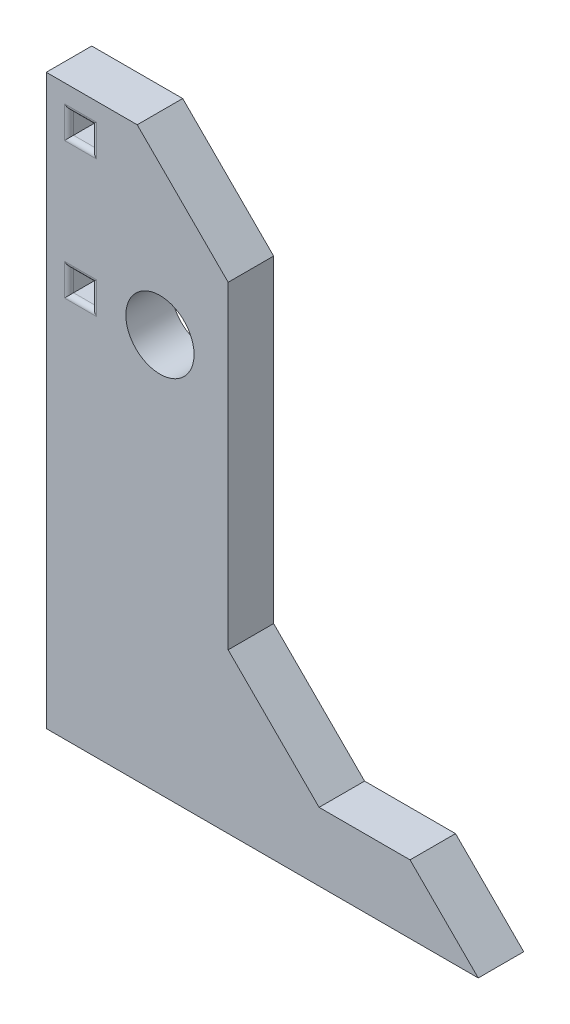
from build123d import *

# Parameters (mm, degrees)
SKETCH3_R           = 15
SKETCH3_W           = 80
SKETCH3_H           = 30
BOSS_EXTRUDE2_DEPTH = 20
SKETCH4_W           = 10
SKETCH4_H           = 10
CUT_EXTRUDE1_DEPTH  = 20
CHAMFER1_SIZE       = 40
FILLET1_R           = 2


with BuildPart() as part:
    # Sketch3 → Boss-Extrude2 (new body)
    # profile 1 of 7: a face of its own
    with BuildSketch(Plane.XY):
        Polygon((-80, 75), (-80, 25), (-80, -26.993709631), (-80, -145), (0, -145), (0, 75), align=None)
        with Locations((-30, 0)):
            Circle(SKETCH3_R, mode=Mode.SUBTRACT)
    # profile 2 of 7: a face of its own
    with BuildSketch(Plane.XY):
        Polygon((-80, 75), (-80, 25), (-80, -26.993709631), (-80, -145), (0, -145), (0, 75), align=None)
        with Locations((-30, 0)):
            Circle(SKETCH3_R, mode=Mode.SUBTRACT)
    # profile 3 of 7: a face of its own
    with BuildSketch(Plane.XY):
        Polygon((-80, 75), (-80, 25), (-80, -26.993709631), (-80, -145), (0, -145), (0, 75), align=None)
        with Locations((-30, 0)):
            Circle(SKETCH3_R, mode=Mode.SUBTRACT)
    # profile 4 of 7: a face of its own
    with BuildSketch(Plane.XY):
        with Locations((-40, -160)):
            Rectangle(SKETCH3_W, SKETCH3_H)
    # profile 5 of 7: a face of its own
    with BuildSketch(Plane.XY):
        with Locations((-40, -160)):
            Rectangle(SKETCH3_W, SKETCH3_H)
    # profile 6 of 7: a face of its own
    with BuildSketch(Plane.XY):
        with Locations((-40, -160)):
            Rectangle(SKETCH3_W, SKETCH3_H)
    # profile 7 of 7: a face of its own
    with BuildSketch(Plane.XY):
        Polygon((120, -145), (0, -145), (0, -175), (53.438707699, -175), (120, -175), align=None)
    extrude(amount=BOSS_EXTRUDE2_DEPTH)

    # Sketch4 → Cut-Extrude1 (cut)
    with BuildSketch(Plane.XY.offset(20)):
        with Locations((-65, 60)):
            Rectangle(SKETCH4_W, SKETCH4_H)
        with Locations((-65, 0)):
            Rectangle(SKETCH4_W, SKETCH4_H)
    extrude(amount=-CUT_EXTRUDE1_DEPTH, mode=Mode.SUBTRACT)

    # Chamfer1
    # the kernel refuses this chamfer: 40 mm, written as the material it adds along each edge
    with BuildSketch(Plane(origin=(0, -145, 0), x_dir=(-0.027495876610586535, 0.9996219169112968, 0), z_dir=(0, 0, 1))) as chamfer1_piece_1:
        Polygon((CHAMFER1_SIZE * 0.999621916911, -CHAMFER1_SIZE * 0.0274958766106), (-CHAMFER1_SIZE * 0.0274958766106, -CHAMFER1_SIZE * 0.999621916911), (0, 0), align=None)
    extrude(amount=20)
    # the kernel refuses this chamfer: 40 mm, written as the material it takes off along each edge
    with BuildSketch(Plane(origin=(120, -145, -102.867319519), x_dir=(-0.9996219169112968, 0.027495876610586317, 0), z_dir=(0, 0, 1)), Plane(origin=(0, 75, -102.867319519), x_dir=(-0.9996219169112968, 0.027495876610586317, 0), z_dir=(0, 0, 1))) as chamfer1_2_piece_1:
        Polygon((CHAMFER1_SIZE * 0.999621916911, CHAMFER1_SIZE * 0.0274958766106), (-CHAMFER1_SIZE * 0.0274958766106, CHAMFER1_SIZE * 0.999621916911), (0, 0), align=None)
    extrude(amount=225.734639037, mode=Mode.SUBTRACT)

    # Fillet1
    fillet1_edges = [part.edges().sort_by_distance(p)[0] for p in [
        (-70, 60, 0),
        (-65, 65, 0),
        (-60, 60, 0),
        (-65, 55, 0),
        (-70, 60, 20),
        (-65, 55, 20),
        (-60, 60, 20),
        (-65, 65, 20),
        (-70, 0, 0),
        (-65, 5, 0),
        (-60, 0, 0),
        (-65, -5, 0),
        (-70, 0, 20),
        (-65, -5, 20),
        (-60, 0, 20),
        (-65, 5, 20),
    ]]
    fillet(fillet1_edges, radius=FILLET1_R)


solid = part.part
